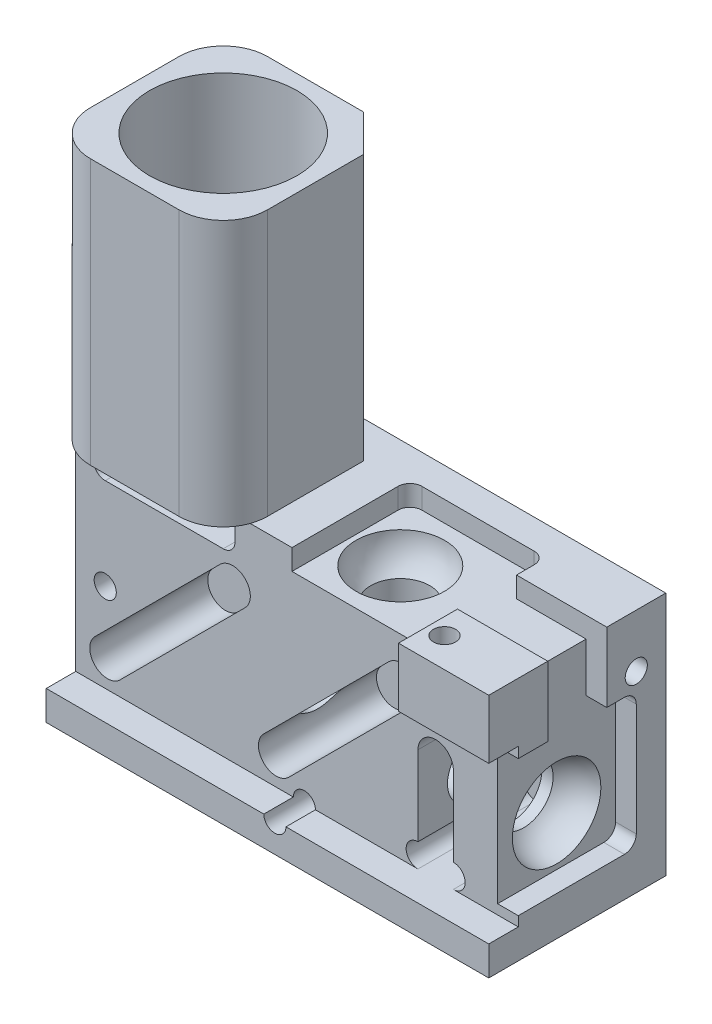
from build123d import *

# Parameters (mm, degrees)
SKETCH1_W                        = 15
SKETCH1_H                        = 6
MAIN_BODY_EXT_DEPTH              = 8.3
EMISSION_PATH_EXT_DEPTH          = 9
SKETCH3_R                        = 1.25
EMISSION_AND_GRIN_CUT_DEPTH      = 20.092931
SKETCH4_R                        = 1
DRUM_LENS_CUT_DEPTH              = 13
SKETCH41_R                       = 1
ADDTL_LIGHT_SOURCE_DEPTH         = 5
SKETCH5_W                        = 15
SKETCH5_H                        = 7.3
FILTERCOVER_CUT1_DEPTH           = 1
TOP_LED_SCREW_W                  = 3.06
TOP_LED_SCREW_H                  = 2
BOSS_EXTRUDE1_DEPTH              = 1
FILTERSET_CUT2_DEPTH             = 4
SKETCH10_R                       = 2.5
EMISSION_LENS_CUT_DEPTH          = 8.5
SKETCH15_R                       = 0.795
MAGNETS_CUT_DEPTH                = 0.9
SCREW_HOLES_CUT_DEPTH            = 20.507434
SCREW_HOLES_CUT_DEPTH_BACK       = 2.5
SKETCH18_R                       = 0.375
EXTERNAL_FILLET_1_R              = 1.5
VERTICAL_PATH_CUT_DEPTH          = 14.011149
VERTICAL_PATH_CUT_DEPTH_BACK     = 4
SKETCH28_R                       = 1.5
CUT_EXTRUDE_ORIGINAL_LIGHT_DEPTH = 0.7
CUT_EXTRUDE_ADDTL_LIGHT_DEPTH    = 0.7
SKETCH29_R                       = 0.375
SIDE_LED_SCREW_DEPTH             = 2.5
SKETCH32_W                       = 2
SKETCH32_H                       = 2.36
SIDE_WIRE_SLOT_CUT_DEPTH         = 0.7
SKETCH45_W                       = 2.36
SKETCH45_H                       = 2
TOP_LED_SLOT_DEPTH               = 0.7
CUT_EXTRUDE16_DEPTH              = 9
CUT_EXTRUDE17_REACH              = 13.945
SKETCH37_R                       = 2
SKETCH51_R                       = 0.375
TOP_LE_SCREW_DEPTH               = 2.1
CUT_EXTRUDE20_DEPTH              = 2


with BuildPart() as part:
    # Sketch1 → Main Body Ext (new body)
    with BuildSketch(Plane(origin=(0, 0, 0), x_dir=(1, 0, 0), z_dir=(0, 1, 0))):
        Rectangle(SKETCH1_W, SKETCH1_H)
    extrude(amount=MAIN_BODY_EXT_DEPTH)

    # Sketch8 → Emission Path Ext (add)
    with BuildSketch(Plane(origin=(0, 8.3, 0), x_dir=(1, 0, 0), z_dir=(0, 1, 0))):
        Polygon((-2.75, 3), (-1.5, 1.75), (-1.5, -3), (-7.5, -3), (-7.5, 3), align=None)
    extrude(amount=EMISSION_PATH_EXT_DEPTH)

    # Sketch3 → Emission and Grin Cut (cut, through all)
    with BuildSketch(Plane.XZ):
        with Locations(Location((-4.5, 0, 0), (0, 0, 270))):
            Circle(SKETCH3_R)
    extrude(amount=-EMISSION_AND_GRIN_CUT_DEPTH, mode=Mode.SUBTRACT)

    # Sketch4 → Drum Lens Cut (cut)
    with BuildSketch(Plane(origin=(7.5, 0, 0), x_dir=(0, 0, -1), z_dir=(1, 0, 0))):
        with Locations((0, 3)):
            Circle(SKETCH4_R)
    extrude(amount=-DRUM_LENS_CUT_DEPTH, mode=Mode.SUBTRACT)

    # Sketch41 → Addtl Light Source (cut)
    with BuildSketch(Plane(origin=(0, 8.3, 0), x_dir=(1, 0, 0), z_dir=(0, 1, 0))):
        with Locations(Location((1.5, 0, 0), (0, 0, 270))):
            Circle(SKETCH41_R)
    extrude(amount=-ADDTL_LIGHT_SOURCE_DEPTH, mode=Mode.SUBTRACT)

    # Sketch5 → FilterCover Cut1 (cut)
    with BuildSketch(Plane.XY.offset(3)):
        with Locations((0, 4.65)):
            Rectangle(SKETCH5_W, SKETCH5_H)
    extrude(amount=-FILTERCOVER_CUT1_DEPTH, mode=Mode.SUBTRACT)

    # Top-LED-Screw → Boss-Extrude1 (add)
    with BuildSketch(Plane.XY.offset(2)):
        with Locations((5.97, 7.3)):
            Rectangle(TOP_LED_SCREW_W, TOP_LED_SCREW_H)
    extrude(amount=BOSS_EXTRUDE1_DEPTH)

    # Sketch6 → FilterSet Cut2 (cut)
    with BuildSketch(Plane.XY.offset(2)):
        with BuildLine():
            Line((5.3, 4.5), (5.3, 1.8))
            ThreePointArc((5.3, 1.8), (5.7, 1.4), (5.3, 1))
            Line((5.3, 1), (4.1, 1))
            ThreePointArc((4.1, 1), (3.7, 1.4), (4.1, 1.8))
            Line((4.1, 1.8), (4.1, 4.5))
            ThreePointArc((4.1, 4.5), (4.7, 5.1), (5.3, 4.5))
        make_face()
        with BuildLine():
            Line((-6.9, 7.9), (-6.9, 7.5))
            ThreePointArc((-6.9, 7.5), (-6.782843, 7.217157), (-6.5, 7.1))
            Line((-6.5, 7.1), (-2.5, 7.1))
            ThreePointArc((-2.5, 7.1), (-2.217157, 7.217157), (-2.1, 7.5))
            Line((-2.1, 7.5), (-2.1, 7.9))
            ThreePointArc((-2.1, 7.9), (-2.217157, 8.182843), (-2.5, 8.3))
            Line((-2.5, 8.3), (-6.5, 8.3))
            ThreePointArc((-6.5, 8.3), (-6.782843, 8.182843), (-6.9, 7.9))
        make_face()
        with BuildLine():
            Line((-2.605887, 6.591169), (-6.848528, 2.348528))
            ThreePointArc((-6.848528, 2.348528), (-6.848528, 1.5), (-6, 1.5))
            Line((-6, 1.5), (-1.757359, 5.742641))
            ThreePointArc((-1.757359, 5.742641), (-1.757359, 6.591169), (-2.605887, 6.591169))
        make_face()
        with BuildLine():
            Line((3.112092, 6.591169), (-1.130548, 2.348528))
            ThreePointArc((-1.130548, 2.348528), (-1.130548, 1.5), (-0.28202, 1.5))
            Line((-0.28202, 1.5), (3.96062, 5.742641))
            ThreePointArc((3.96062, 5.742641), (3.96062, 6.591169), (3.112092, 6.591169))
        make_face()
    extrude(amount=-FILTERSET_CUT2_DEPTH, mode=Mode.SUBTRACT)

    # Sketch10 → Emission Lens Cut (cut)
    with BuildSketch(Plane(origin=(0, 17.3, 0), x_dir=(1, 0, 0), z_dir=(0, 1, 0))):
        with Locations(Location((-4.5, 0, 0), (0, 0, 270))):
            Circle(SKETCH10_R)
    extrude(amount=-EMISSION_LENS_CUT_DEPTH, mode=Mode.SUBTRACT)

    # Sketch15 → Magnets Cut (cut)
    with BuildSketch(Plane.XZ):
        with Locations(Location((-6.25, -1.875, 0), (0, 0, 270))):
            Circle(SKETCH15_R)
        with Locations(Location((-6.25, 1.875, 0), (0, 0, 270))):
            Circle(SKETCH15_R)
        with Locations(Location((-1.5, 0, 0), (0, 0, 270))):
            Circle(SKETCH15_R)
    extrude(amount=-MAGNETS_CUT_DEPTH, mode=Mode.SUBTRACT)

    # Sketch18 → Screw Holes Cut (cut, two sides: drawn at the far end of the back side and taken through both)
    with BuildSketch(Plane.XY.offset(2).offset(-SCREW_HOLES_CUT_DEPTH_BACK)):
        with Locations(Location((-6.5, 4, 0), (0, 0, 180))):
            Circle(SKETCH18_R)
        with Locations(Location((6, 5.8, 0), (0, 0, 180))):
            Circle(SKETCH18_R)
        with Locations((0.25, 1)):
            Circle(SKETCH18_R)
    extrude(amount=SCREW_HOLES_CUT_DEPTH + SCREW_HOLES_CUT_DEPTH_BACK, mode=Mode.SUBTRACT)

    # External Fillet 1
    # the kernel refuses this fillet: 1.5 mm, written as the material it takes off along each edge
    with BuildSketch(Plane(origin=(-7.5, -3.75, -3), x_dir=(1, 0, 0), z_dir=(0, 1, 0))) as external_fillet_1_piece_1:
        with BuildLine():
            CenterArc((EXTERNAL_FILLET_1_R, -EXTERNAL_FILLET_1_R), EXTERNAL_FILLET_1_R, 90, 90)
            Line((0, -EXTERNAL_FILLET_1_R), (0, 0))
            Line((0, 0), (EXTERNAL_FILLET_1_R, 0))
        make_face()
    extrude(amount=24.8, mode=Mode.SUBTRACT)
    with BuildSketch(Plane(origin=(-1.5, 8.3, 3), x_dir=(0, 0, -1), z_dir=(0, 1, 0))) as external_fillet_1_piece_2:
        with BuildLine():
            CenterArc((EXTERNAL_FILLET_1_R, EXTERNAL_FILLET_1_R), EXTERNAL_FILLET_1_R, 180, 90)
            Line((0, EXTERNAL_FILLET_1_R), (0, 0))
            Line((0, 0), (EXTERNAL_FILLET_1_R, 0))
        make_face()
    extrude(amount=12.75, mode=Mode.SUBTRACT)

    # Sketch28 → Vertical-Path-Cut (cut, two sides: drawn at the far end of the back side and taken through both)
    with BuildSketch(Plane(origin=(0, 7.1, 0), x_dir=(1, 0, 0), z_dir=(0, 1, 0)).offset(-VERTICAL_PATH_CUT_DEPTH_BACK)):
        with Locations(Location((-4.5, 0, 0), (0, 0, 180))):
            Circle(SKETCH28_R)
    extrude(amount=VERTICAL_PATH_CUT_DEPTH + VERTICAL_PATH_CUT_DEPTH_BACK, mode=Mode.SUBTRACT)

    # Sketch12 → Cut-Extrude Original Light (cut)
    with BuildSketch(Plane(origin=(7.5, 0, 0), x_dir=(0, 0, -1), z_dir=(1, 0, 0))):
        with BuildLine():
            Line((1.6, 5.94), (-1.6, 5.94))
            Line((-1.6, 5.94), (-2, 5.94))
            Line((-2, 5.94), (-2, 1.33))
            Line((-2, 1.33), (1.6, 1.33))
            ThreePointArc((1.6, 1.33), (1.882843, 1.447157), (2, 1.73))
            Line((2, 1.73), (2, 5.54))
            ThreePointArc((2, 5.54), (1.882843, 5.822843), (1.6, 5.94))
        make_face()
    extrude(amount=-CUT_EXTRUDE_ORIGINAL_LIGHT_DEPTH, mode=Mode.SUBTRACT)

    # Sketch44 → Cut-Extrude Addtl Light (cut)
    with BuildSketch(Plane(origin=(0, 8.3, 0), x_dir=(1, 0, 0), z_dir=(0, 1, 0))):
        with BuildLine():
            Line((-0.17, -2), (4.44, -2))
            Line((4.44, -2), (4.44, 1.6))
            ThreePointArc((4.44, 1.6), (4.322843, 1.882843), (4.04, 2))
            Line((4.04, 2), (0.23, 2))
            ThreePointArc((0.23, 2), (-0.052843, 1.882843), (-0.17, 1.6))
            Line((-0.17, 1.6), (-0.17, -2))
        make_face()
    extrude(amount=-CUT_EXTRUDE_ADDTL_LIGHT_DEPTH, mode=Mode.SUBTRACT)

    # Sketch29 → Side-LED-Screw (cut)
    with BuildSketch(Plane(origin=(7.5, 0, 0), x_dir=(0, 0, -1), z_dir=(1, 0, 0))):
        with Locations((2, 6.5)):
            Circle(SKETCH29_R)
    extrude(amount=-SIDE_LED_SCREW_DEPTH, mode=Mode.SUBTRACT)

    # Sketch32 → Side-Wire-Slot-Cut (cut)
    with BuildSketch(Plane(origin=(7.5, 0, 0), x_dir=(0, 0, -1), z_dir=(1, 0, 0))):
        with Locations((0, 7.12)):
            Rectangle(SKETCH32_W, SKETCH32_H)
    extrude(amount=-SIDE_WIRE_SLOT_CUT_DEPTH, mode=Mode.SUBTRACT)

    # Sketch45 → Top-LED-slot (cut)
    with BuildSketch(Plane(origin=(0, 8.3, 0), x_dir=(1, 0, 0), z_dir=(0, 1, 0))):
        with Locations((5.62, 0)):
            Rectangle(SKETCH45_W, SKETCH45_H)
    extrude(amount=-TOP_LED_SLOT_DEPTH, mode=Mode.SUBTRACT)

    # Sketch33 → Side-BallLens_Cut (revolve, cut)
    with BuildSketch(Plane.XY, mode=Mode.PRIVATE) as side_balllens_cut_sk:
        with BuildLine():
            Line((6.8, 3), (5.3, 3))
            ThreePointArc((5.3, 3), (5.73934, 4.06066), (6.8, 4.5))
            Line((6.8, 4.5), (6.8, 3))
        make_face()
    revolve(side_balllens_cut_sk.sketch.rotate(Axis((6.8, 3, 0), (-1, 0, 0)), 84.26086), axis=Axis((6.8, 3, 0), (-1, 0, 0)), mode=Mode.SUBTRACT)

    # Sketch47 → Top-BallLens_Cut (revolve, cut)
    with BuildSketch(Plane(origin=(1.5, 0, 0), x_dir=(0, 0, -1), z_dir=(1, 0, 0))):
        with BuildLine():
            Line((-1.5, 7.6), (0, 7.6))
            Line((0, 7.6), (0, 6.137287))
            ThreePointArc((0, 6.137287), (-1.04756, 6.563498), (-1.5, 7.6))
        make_face()
    revolve(axis=Axis((1.5, 7.6, 0), (0, -1, 0)), mode=Mode.SUBTRACT)

    # Sketch36 → Cut-Extrude16 (cut)
    with BuildSketch(Plane(origin=(0, 17.3, 0), x_dir=(1, 0, 0), z_dir=(0, 1, 0))):
        with BuildLine():
            Line((-7.5, -1.5), (-7.5, -3))
            Line((-7.5, -3), (-6, -3))
            ThreePointArc((-6, -3), (-7.06066, -2.56066), (-7.5, -1.5))
        make_face()
    extrude(amount=-CUT_EXTRUDE16_DEPTH, mode=Mode.SUBTRACT)

    # Sketch37 → Cut-Extrude17 (cut, up to next)
    with BuildSketch(Plane(origin=(0, 8.8, 0), x_dir=(1, 0, 0), z_dir=(0, 1, 0)), mode=Mode.PRIVATE) as cut_extrude17_sk1:
        with Locations(Location((-4.5, 0, 0), (0, 0, 180))):
            Circle(SKETCH37_R)
    cut_extrude17_tool1 = extrude(cut_extrude17_sk1.sketch, amount=-CUT_EXTRUDE17_REACH, mode=Mode.PRIVATE) & part.part
    add(cut_extrude17_tool1.solids().sort_by_distance((-4.5, 8.8, 0))[0], mode=Mode.SUBTRACT)

    # Sketch51 → Top-LE-Screw (cut)
    with BuildSketch(Plane(origin=(0, 8.3, 0), x_dir=(1, 0, 0), z_dir=(0, 1, 0))):
        with Locations(Location((5, -2, 0), (0, 0, 270))):
            Circle(SKETCH51_R)
    extrude(amount=-TOP_LE_SCREW_DEPTH, mode=Mode.SUBTRACT)

    # Notch → Cut-Extrude20 (cut)
    with BuildSketch(Plane.XZ):
        Polygon((3.151388, -1.7476), (1.584933, -1.7476), (1.584933, -3), (5.029987, -3), align=None)
        Polygon((1.584933, -3), (1.584933, -1.7476), (0.75, -3), align=None)
    extrude(amount=-CUT_EXTRUDE20_DEPTH, mode=Mode.SUBTRACT)


solid = part.part
